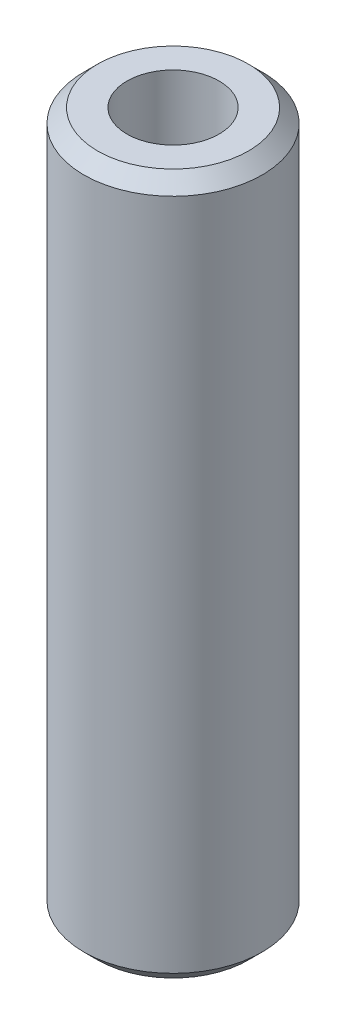
from build123d import *

# Parameters (mm, degrees)
SKETCH1_R           = 12.5
BOSS_EXTRUDE1_DEPTH = 98.193766463
SKETCH2_R           = 6.453628028
CUT_EXTRUDE1_DEPTH  = 100.772319669
CHAMFER1_SIZE       = 1.935386359


with BuildPart() as part:
    # Sketch1 → Boss-Extrude1 (new body)
    with BuildSketch(Plane(origin=(0, 0, 0), x_dir=(1, 0, 0), z_dir=(0, 1, 0))):
        Circle(SKETCH1_R)
    extrude(amount=BOSS_EXTRUDE1_DEPTH)

    # Sketch2 → Cut-Extrude1 (cut, through all)
    with BuildSketch(Plane(origin=(0, 0, 0), x_dir=(1, 0, 0), z_dir=(0, 1, 0))):
        Circle(SKETCH2_R)
    extrude(amount=CUT_EXTRUDE1_DEPTH, mode=Mode.SUBTRACT)

    # Chamfer1
    chamfer1_edges = [part.edges().sort_by_distance(p)[0] for p in [
        (-12.5, 98.193766463, 0),
        (-12.5, 0, 0),
    ]]
    chamfer(chamfer1_edges, length=CHAMFER1_SIZE)


solid = part.part
